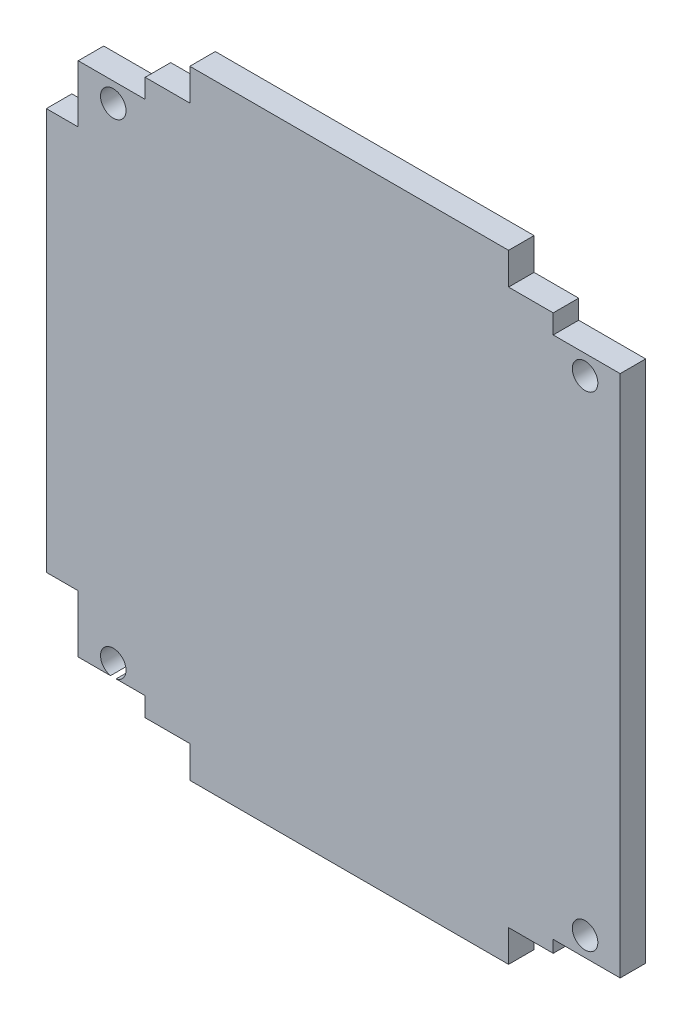
from build123d import *

# Parameters (mm, degrees)
BOSS_EXTRUDE1_DEPTH = 4
SKETCH2_R           = 2
CUT_EXTRUDE1_DEPTH  = 10


with BuildPart() as part:
    # Sketch1 → Boss-Extrude1 (new body)
    with BuildSketch(Plane.XY):
        Polygon((-42.5, -39.951010266), (-42.5, -30.951010266), (-47.5, -30.951010266), (-47.5, 32.048989734), (-42.5, 32.048989734), (-42.5, 41.048989734), (-32, 41.048989734), (-32, 44.048989734), (-25, 44.048989734), (-25, 49.048989734), (25, 49.048989734), (25, 44.048989734), (32, 44.048989734), (32, 41.048989734), (42.5, 41.048989734), (42.5, -41.048989734), (32, -41.048989734), (32, -42.951010266), (25, -42.951010266), (25, -47.951010266), (-25, -47.951010266), (-25, -42.951010266), (-32, -42.951010266), (-32, -39.951010266), align=None)
    extrude(amount=BOSS_EXTRUDE1_DEPTH)

    # Sketch2 → Cut-Extrude1 (cut)
    with BuildSketch(Plane.XY.offset(4)):
        with Locations((-37.000054576, 38.000043308)):
            Circle(SKETCH2_R)
        with Locations((36.999973464, 38)):
            Circle(SKETCH2_R)
        with Locations((-36.999973464, -38)):
            Circle(SKETCH2_R)
        with Locations((37.000054576, -38.000043308)):
            Circle(SKETCH2_R)
    extrude(amount=-CUT_EXTRUDE1_DEPTH, mode=Mode.SUBTRACT)


solid = part.part
